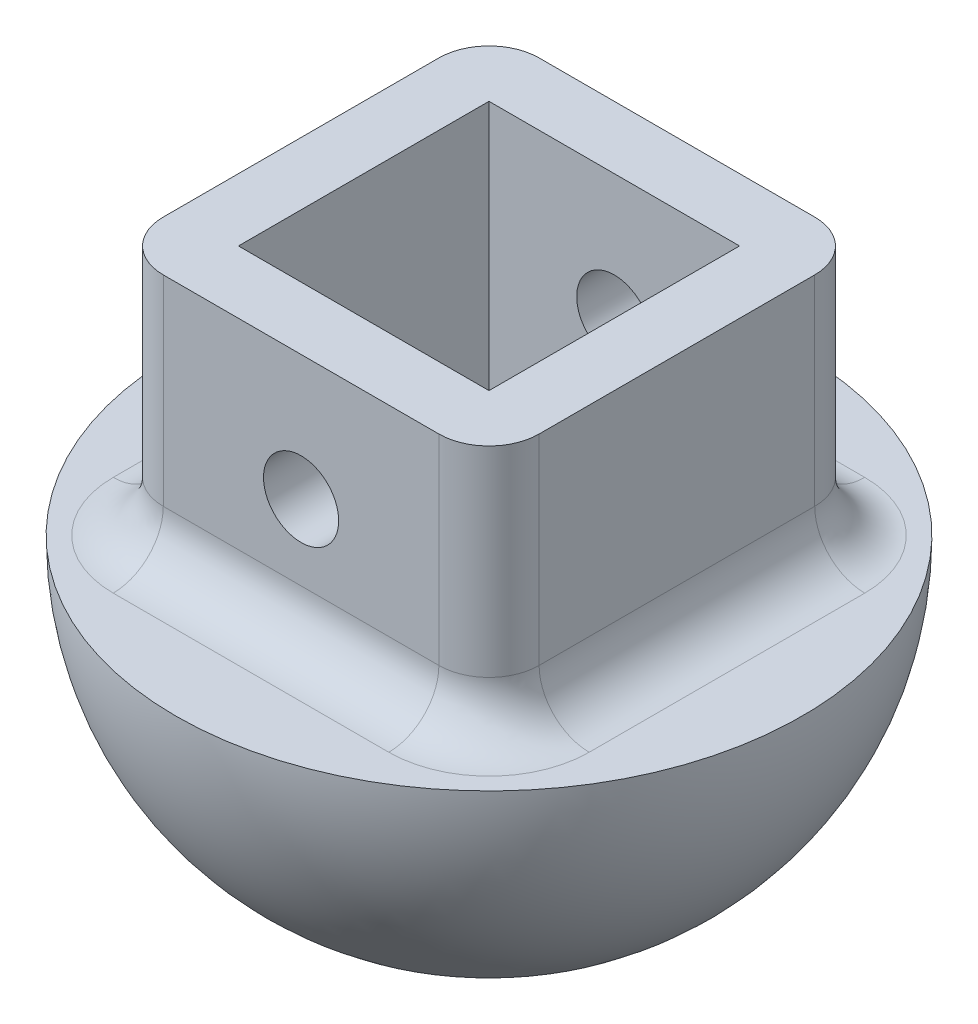
from build123d import *

# Parameters (mm, degrees)
REVOLVE2_ANGLE          = 180
SKETCH1_W               = 15
SKETCH1_H               = 15
SKETCH1_W_2             = 10
SKETCH1_H_2             = 10
BOSS_EXTRUDE1_DEPTH     = 10
CUT_EXTRUDE1_DEPTH      = 20
CUT_EXTRUDE1_DEPTH_BACK = 10
SKETCH2_R               = 1.5
FILLET1_R               = 2


with BuildPart() as part:
    # Sketch4 → Revolve2 (revolve)
    with BuildSketch(Plane(origin=(0, 0, 0), x_dir=(1, 0, 0), z_dir=(0, 1, 0))):
        with BuildLine():
            Line((12.5, 0), (-12.5, 0))
            ThreePointArc((-12.5, 0), (0, -12.5), (12.5, 0))
        make_face()
    revolve(axis=Axis((-12.5, 0, 0), (1, 0, 0)), revolution_arc=REVOLVE2_ANGLE)

    # Sketch1 → Boss-Extrude1 (add)
    with BuildSketch(Plane(origin=(0, 0, 0), x_dir=(1, 0, 0), z_dir=(0, 1, 0))):
        Rectangle(SKETCH1_W, SKETCH1_H)
        Rectangle(SKETCH1_W_2, SKETCH1_H_2, mode=Mode.SUBTRACT)
    extrude(amount=BOSS_EXTRUDE1_DEPTH)

    # Sketch2 → Cut-Extrude1 (cut, two sides: drawn at the far end of the back side and taken through both)
    with BuildSketch(Plane(origin=(0, 0, 5), x_dir=(-1, 0, 0), z_dir=(0, 0, -1)).offset(-CUT_EXTRUDE1_DEPTH_BACK)):
        with Locations((0, 5)):
            Circle(SKETCH2_R)
    extrude(amount=CUT_EXTRUDE1_DEPTH + CUT_EXTRUDE1_DEPTH_BACK, mode=Mode.SUBTRACT)

    # Fillet1
    fillet1_edges = [part.edges().sort_by_distance(p)[0] for p in [
        (-7.5, 5, 7.5),
        (-7.5, 5, -7.5),
        (7.5, 5, -7.5),
        (7.5, 5, 7.5),
        (0, 0, -7.5),
        (7.5, 0, 0),
        (-7.5, 0, 0),
        (0, 0, 7.5),
    ]]
    fillet(fillet1_edges, radius=FILLET1_R)


solid = part.part
